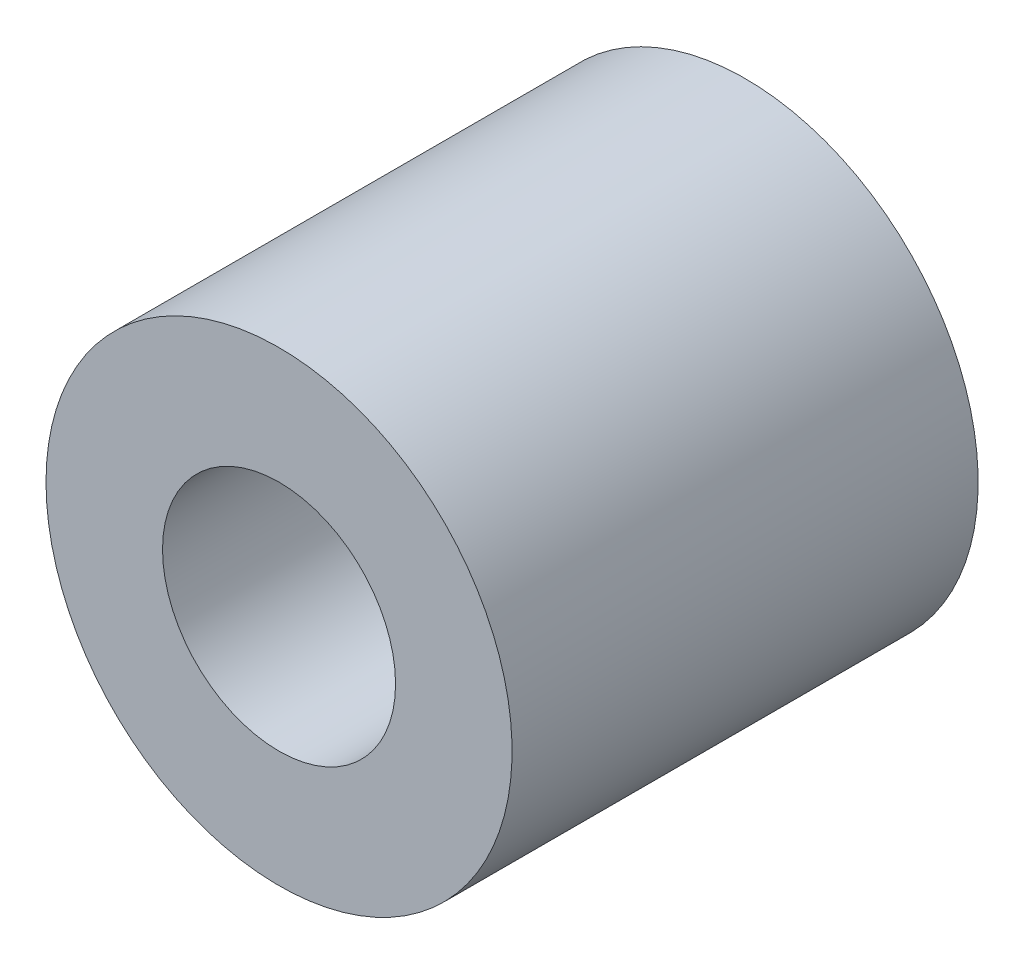
from build123d import *

# Parameters (mm, degrees)
SKETCH1_R           = 9.525
SKETCH1_R_2         = 4.7625
BOSS_EXTRUDE1_DEPTH = 9.525


with BuildPart() as part:
    # Sketch1 → Boss-Extrude1 (new, symmetric)
    with BuildSketch(Plane.XY):
        Circle(SKETCH1_R)
        Circle(SKETCH1_R_2, mode=Mode.SUBTRACT)
    extrude(amount=BOSS_EXTRUDE1_DEPTH, both=True)


solid = part.part
